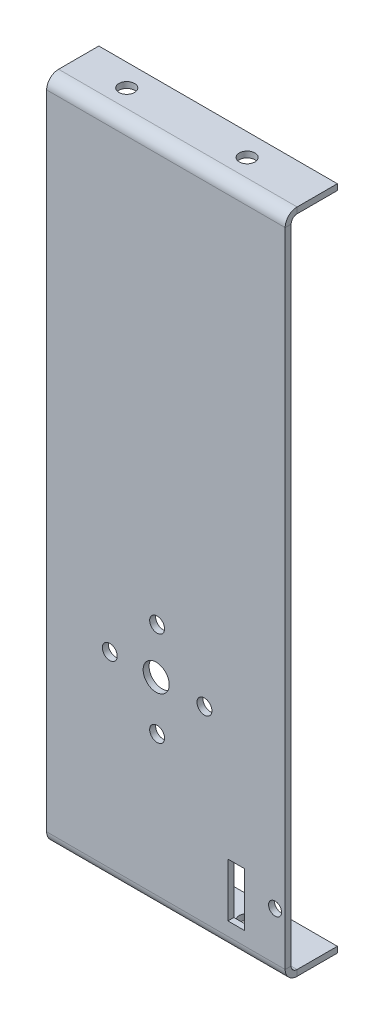
from build123d import *

# Parameters (mm, degrees)
SKETCH1_W                    = 64
SKETCH1_H                    = 178.8
BASE_FLANGE1_DEPTH           = 1.6
EDGE_FLANGE1_STRIP_W         = 9.6
EDGE_FLANGE1_STRIP_H         = 1.6
EDGE_FLANGE1_STRIP_CUT_DEPTH = 64
EDGE_FLANGE1_DEPTH           = 64
EDGE_FLANGE2_STRIP_W         = 9.6
EDGE_FLANGE2_STRIP_H         = 1.6
EDGE_FLANGE2_STRIP_CUT_DEPTH = 64
EDGE_FLANGE2_DEPTH           = 64
SKETCH12_R                   = 2.1
CUT_EXTRUDE1_DEPTH           = 1000
SKETCH13_R                   = 1.75
SKETCH13_R_2                 = 2
CUT_EXTRUDE2_DEPTH           = 1000
SKETCH14_R                   = 3.5
CUT_EXTRUDE3_DEPTH           = 5
SKETCH15_W                   = 4.498408697
SKETCH15_H                   = 14.372964376
CUT_EXTRUDE4_DEPTH           = 10


# Sheet-metal steps are written as plain solids
with BuildPart() as part:
    # Sketch1 → Base-Flange1 (new body)
    with BuildSketch(Plane.XY):
        with Locations((32, 89.4)):
            Rectangle(SKETCH1_W, SKETCH1_H)
    extrude(amount=-BASE_FLANGE1_DEPTH)

    # Edge-Flange1 strip (across the edge) → Edge-Flange1 strip cut (cut)
    with BuildSketch(Plane(origin=(64, 0, -1.6), x_dir=(0, 1, 0), z_dir=(-1, 0, 0))):
        with Locations((-1.6, -0.8)):
            Rectangle(EDGE_FLANGE1_STRIP_W, EDGE_FLANGE1_STRIP_H)
    extrude(amount=EDGE_FLANGE1_STRIP_CUT_DEPTH, mode=Mode.SUBTRACT)

    # Edge-Flange1 section (across the edge) → Edge-Flange1 (add)
    with BuildSketch(Plane(origin=(64, 0, -1.6), x_dir=(0, 1, 0), z_dir=(-1, 0, 0))):
        with BuildLine():
            Line((0, 1.6), (0, 12.4))
            Line((0, 12.4), (1.6, 12.4))
            Line((1.6, 12.4), (1.6, 1.6))
            ThreePointArc((1.6, 1.6), (2.06862915, 0.46862915), (3.2, 0))
            Line((3.2, 0), (3.2, -1.6))
            ThreePointArc((3.2, -1.6), (0.9372583, -0.6627417), (0, 1.6))
        make_face()
    extrude(amount=EDGE_FLANGE1_DEPTH)

    # Edge-Flange2 strip (across the edge) → Edge-Flange2 strip cut (cut)
    with BuildSketch(Plane(origin=(0, 178.8, -1.6), x_dir=(0, -1, 0), z_dir=(1, 0, 0))):
        with Locations((-1.6, -0.8)):
            Rectangle(EDGE_FLANGE2_STRIP_W, EDGE_FLANGE2_STRIP_H)
    extrude(amount=EDGE_FLANGE2_STRIP_CUT_DEPTH, mode=Mode.SUBTRACT)

    # Edge-Flange2 section (across the edge) → Edge-Flange2 (add)
    with BuildSketch(Plane(origin=(0, 178.8, -1.6), x_dir=(0, -1, 0), z_dir=(1, 0, 0))):
        with BuildLine():
            Line((0, 1.6), (0, 12.4))
            Line((0, 12.4), (1.6, 12.4))
            Line((1.6, 12.4), (1.6, 1.6))
            ThreePointArc((1.6, 1.6), (2.06862915, 0.46862915), (3.2, 0))
            Line((3.2, 0), (3.2, -1.6))
            ThreePointArc((3.2, -1.6), (0.9372583, -0.6627417), (0, 1.6))
        make_face()
    extrude(amount=EDGE_FLANGE2_DEPTH)

    # Sketch12 → Cut-Extrude1 (cut)
    with BuildSketch(Plane.XZ):
        with Locations(Location((45.791182174, -8, 0), (0, 0, 270))):
            Circle(SKETCH12_R)
        with Locations(Location((13.491811911, -8, 0), (0, 0, 270))):
            Circle(SKETCH12_R)
    extrude(amount=-CUT_EXTRUDE1_DEPTH, mode=Mode.SUBTRACT)

    # Sketch13 → Cut-Extrude2 (cut)
    with BuildSketch(Plane.XY):
        with Locations((61.291182174, 16)):
            Circle(SKETCH13_R)
        with Locations((29.639685291, 40.768563608)):
            Circle(SKETCH13_R_2)
        with Locations((42.339685291, 53.468563608)):
            Circle(SKETCH13_R_2)
        with Locations((16.939685291, 53.468563608)):
            Circle(SKETCH13_R_2)
        with Locations((29.639685291, 66.168563608)):
            Circle(SKETCH13_R_2)
    extrude(amount=-CUT_EXTRUDE2_DEPTH, mode=Mode.SUBTRACT)

    # Sketch14 → Cut-Extrude3 (cut)
    with BuildSketch(Plane.XY):
        with Locations((29.384576347, 53.812205541)):
            Circle(SKETCH14_R)
    extrude(amount=-CUT_EXTRUDE3_DEPTH, mode=Mode.SUBTRACT)

    # Sketch15 → Cut-Extrude4 (cut)
    with BuildSketch(Plane.XY):
        with Locations((50.891201279, 13.989760377)):
            Rectangle(SKETCH15_W, SKETCH15_H)
    extrude(amount=-CUT_EXTRUDE4_DEPTH, mode=Mode.SUBTRACT)


solid = part.part
